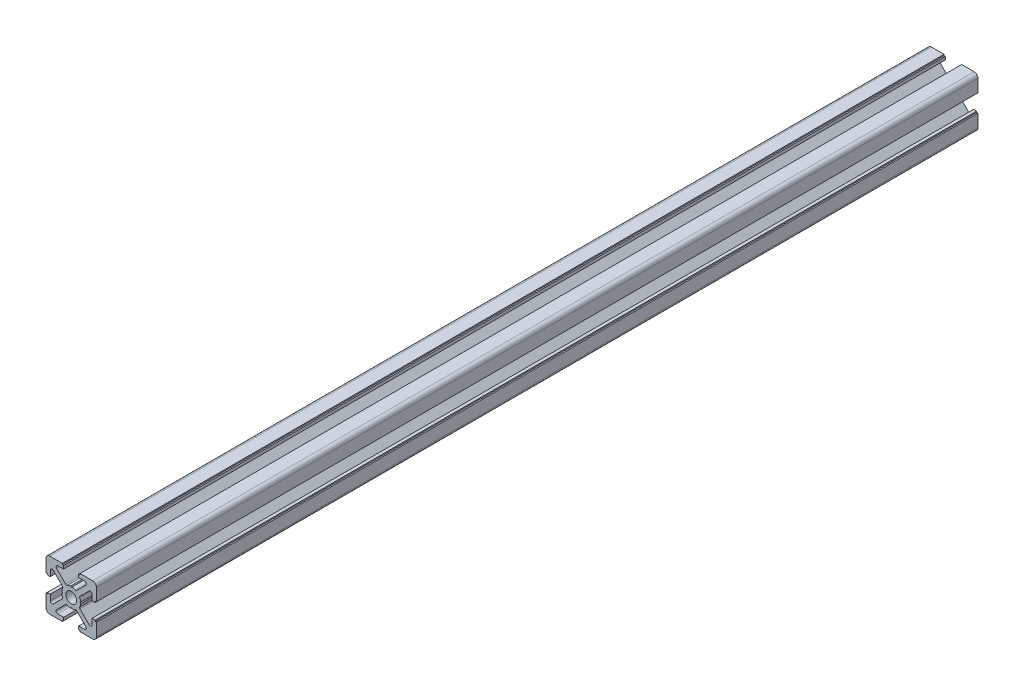
from build123d import *

# Parameters (mm, degrees)
SALIENTE_EXTRUIR1_DEPTH = 350


with BuildPart() as part:
    # Model → Saliente-Extruir1 (new body)
    with BuildSketch(Plane.XY):
        with BuildLine():
            Line((-3.499999948, -9.5), (-3.499999948, -10))
            Line((-3.499999948, -10), (-8.499999948, -10))
            ThreePointArc((-8.499999948, -10), (-9.56066012, -9.560660172), (-9.999999948, -8.5))
            Line((-9.999999948, -8.5), (-9.999999948, -3.5))
            Line((-9.999999948, -3.5), (-9.499999948, -3.5))
            Line((-9.499999948, -3.5), (-9.499999948, -3))
            Line((-9.499999948, -3), (-8.299999956, -3))
            Line((-8.299999956, -3), (-8.299999953, -5.299390332))
            ThreePointArc((-8.299999953, -5.299390332), (-7.867878354, -5.946106004), (-7.105025204, -5.794365076))
            Line((-7.105025204, -5.794365076), (-3.486125749, -2.175465599))
            ThreePointArc((-3.486125749, -2.175465599), (-3.377739374, -2.013253925), (-3.339679141, -1.821912209))
            ThreePointArc((-3.339679141, -1.821912209), (-3.351896811, -1.712055943), (-3.387952737, -1.607568428))
            ThreePointArc((-3.387952737, -1.607568428), (-3.622453068, -0.969708344), (-3.737980738, -0.299999999))
            Line((-3.737980738, -0.299999999), (-3.45, 0))
            Line((-3.45, 0), (-3.737980738, 0.300000001))
            ThreePointArc((-3.737980738, 0.300000001), (-3.622452965, 0.969708714), (-3.387952398, 1.607569144))
            ThreePointArc((-3.387952398, 1.607569144), (-3.351896724, 1.71205633), (-3.339679141, 1.821912209))
            ThreePointArc((-3.339679141, 1.821912209), (-3.377739374, 2.013253924), (-3.486125749, 2.175465599))
            Line((-3.486125749, 2.175465599), (-7.105025204, 5.794365076))
            ThreePointArc((-7.105025204, 5.794365076), (-7.867878354, 5.946106004), (-8.299999953, 5.299390332))
            Line((-8.299999953, 5.299390332), (-8.299999948, 3))
            Line((-8.299999948, 3), (-9.499999948, 3))
            Line((-9.499999948, 3), (-9.499999948, 3.5))
            Line((-9.499999948, 3.5), (-9.999999948, 3.5))
            Line((-9.999999948, 3.5), (-9.999999948, 8.5))
            ThreePointArc((-9.999999948, 8.5), (-9.56066012, 9.560660172), (-8.499999948, 10))
            Line((-8.499999948, 10), (-3.499999948, 10))
            Line((-3.499999948, 10), (-3.499999948, 9.5))
            Line((-3.499999948, 9.5), (-2.999999948, 9.5))
            Line((-2.999999948, 9.5), (-2.999999948, 8.3))
            Line((-2.999999948, 8.3), (-5.299390284, 8.3))
            ThreePointArc((-5.299390284, 8.3), (-5.794365116, 8.094974661), (-5.999390284, 7.599999758))
            ThreePointArc((-5.999390284, 7.599999758), (-5.94610591, 7.332121486), (-5.794365032, 7.105025255))
            Line((-5.794365032, 7.105025255), (-2.175465567, 3.486125767))
            ThreePointArc((-2.175465567, 3.486125767), (-1.907084491, 3.346986883), (-1.607568495, 3.387952706))
            ThreePointArc((-1.607568495, 3.387952706), (-0.969708361, 3.622453006), (-0.300000001, 3.737980738))
            Line((-0.300000001, 3.737980738), (0, 3.45))
            Line((0, 3.45), (0.299999999, 3.737980739))
            ThreePointArc((0.299999999, 3.737980739), (0.969708759, 3.622452864), (1.607569257, 3.387952344))
            ThreePointArc((1.607569257, 3.387952344), (1.907084907, 3.346986955), (2.175465567, 3.486125767))
            Line((2.175465567, 3.486125767), (5.794365032, 7.105025255))
            ThreePointArc((5.794365032, 7.105025255), (5.946105957, 7.332121598), (5.999390284, 7.6))
            ThreePointArc((5.999390284, 7.6), (5.79436503, 8.094974747), (5.299390284, 8.3))
            Line((5.299390284, 8.3), (2.999999948, 8.3))
            Line((2.999999948, 8.3), (2.999999948, 9.5))
            Line((2.999999948, 9.5), (3.499999948, 9.5))
            Line((3.499999948, 9.5), (3.499999948, 10))
            Line((3.499999948, 10), (8.499999948, 10))
            ThreePointArc((8.499999948, 10), (9.56066012, 9.560660172), (9.999999948, 8.5))
            Line((9.999999948, 8.5), (9.999999948, 3.5))
            Line((9.999999948, 3.5), (9.499999948, 3.5))
            Line((9.499999948, 3.5), (9.499999948, 3))
            Line((9.499999948, 3), (8.299999956, 3))
            Line((8.299999956, 3), (8.299999953, 5.299390332))
            ThreePointArc((8.299999953, 5.299390332), (7.867878354, 5.946106004), (7.105025204, 5.794365076))
            Line((7.105025204, 5.794365076), (3.486125749, 2.175465599))
            ThreePointArc((3.486125749, 2.175465599), (3.377739341, 2.013253845), (3.339679141, 1.821912036))
            ThreePointArc((3.339679141, 1.821912036), (3.351896688, 1.712056493), (3.38795218, 1.607569602))
            ThreePointArc((3.38795218, 1.607569602), (3.622452774, 0.969708926), (3.737980738, 0.3))
            Line((3.737980738, 0.3), (3.45, 0))
            Line((3.45, 0), (3.737980738, -0.300000001))
            ThreePointArc((3.737980738, -0.300000001), (3.622452774, -0.969708938), (3.38795218, -1.607569603))
            ThreePointArc((3.38795218, -1.607569603), (3.351896649, -1.712056662), (3.339679141, -1.821912382))
            ThreePointArc((3.339679141, -1.821912382), (3.377739407, -2.013254005), (3.486125749, -2.175465599))
            Line((3.486125749, -2.175465599), (7.105025204, -5.794365076))
            ThreePointArc((7.105025204, -5.794365076), (7.867878354, -5.946106004), (8.299999953, -5.299390332))
            Line((8.299999953, -5.299390332), (8.299999956, -3))
            Line((8.299999956, -3), (9.499999948, -3))
            Line((9.499999948, -3), (9.499999948, -3.5))
            Line((9.499999948, -3.5), (9.999999948, -3.5))
            Line((9.999999948, -3.5), (9.999999948, -8.5))
            ThreePointArc((9.999999948, -8.5), (9.56066012, -9.560660172), (8.499999948, -10))
            Line((8.499999948, -10), (3.499999948, -10))
            Line((3.499999948, -10), (3.499999948, -9.5))
            Line((3.499999948, -9.5), (2.999999948, -9.5))
            Line((2.999999948, -9.5), (2.999999948, -8.3))
            Line((2.999999948, -8.3), (5.299390284, -8.3))
            ThreePointArc((5.299390284, -8.3), (5.79436503, -8.094974747), (5.999390284, -7.6))
            ThreePointArc((5.999390284, -7.6), (5.946105957, -7.332121598), (5.794365032, -7.105025255))
            Line((5.794365032, -7.105025255), (2.175465567, -3.486125767))
            ThreePointArc((2.175465567, -3.486125767), (1.907085699, -3.346987092), (1.607570709, -3.387951655))
            ThreePointArc((1.607570709, -3.387951655), (0.969709536, -3.622452668), (0.3, -3.737980738))
            Line((0.3, -3.737980738), (0, -3.45))
            Line((0, -3.45), (-0.3, -3.737980738))
            ThreePointArc((-0.3, -3.737980738), (-0.969708852, -3.622452887), (-1.607569414, -3.38795227))
            ThreePointArc((-1.607569414, -3.38795227), (-1.907084992, -3.34698697), (-2.175465567, -3.486125767))
            Line((-2.175465567, -3.486125767), (-5.794365032, -7.105025255))
            ThreePointArc((-5.794365032, -7.105025255), (-5.946106003, -7.33212171), (-5.999390284, -7.600000242))
            ThreePointArc((-5.999390284, -7.600000242), (-5.794364945, -8.094974833), (-5.299390284, -8.3))
            Line((-5.299390284, -8.3), (-2.999999948, -8.3))
            Line((-2.999999948, -8.3), (-2.999999948, -9.5))
            Line((-2.999999948, -9.5), (-3.499999948, -9.5))
        make_face()
        with BuildLine():
            ThreePointArc((-2.15, -7.45e-07), (3.72e-07, -2.150000372), (2.15, 0))
            ThreePointArc((2.15, 0), (-3.72e-07, 2.149999628), (-2.15, -7.45e-07))
        make_face(mode=Mode.SUBTRACT)
    extrude(amount=SALIENTE_EXTRUIR1_DEPTH)


solid = part.part
